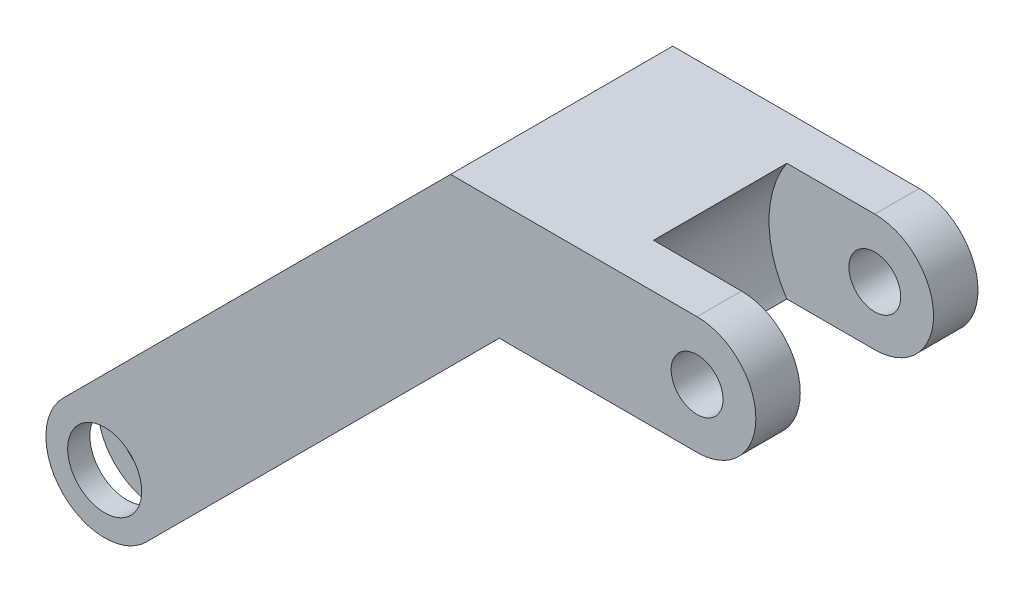
from build123d import *

# Parameters (mm, degrees)
SALIENTE_EXTRUIR1_DEPTH = 7.5
CROQUIS2_W              = 2
CROQUIS2_H              = 3.96875
CORTAR_EXTRUIR1_DEPTH   = 15
CROQUIS4_R              = 2.5
CORTAR_EXTRUIR2_DEPTH   = 15
CROQUIS5_R              = 7.14375
CORTAR_EXTRUIR3_DEPTH   = 4.5
CROQUIS13_R             = 1.75
CORTAR_EXTRUIR8_DEPTH   = 55.748876273
CROQUIS10_R             = 4
CROQUIS10_R_2           = 2
CORTAR_EXTRUIR7_DEPTH   = 1.5
NERVIO1_REACH           = 55.185
CROQUIS12_WALL_W        = 119.773509912
CROQUIS12_WALL_H        = 3


with BuildPart() as part:
    # Croquis1 → Saliente-Extruir1 (new, symmetric)
    with BuildSketch(Plane.XY):
        with BuildLine():
            Line((23.356089924, 28.96875), (-2.806330038, 2.806330038))
            ThreePointArc((-2.806330038, 2.806330038), (-2.806330038, -2.806330038), (2.806330038, -2.806330038))
            Line((2.806330038, -2.806330038), (26.643910076, 21.03125))
            Line((26.643910076, 21.03125), (40, 21.03125))
            ThreePointArc((40, 21.03125), (43.96875, 25), (40, 28.96875))
            Line((40, 28.96875), (23.356089924, 28.96875))
        make_face()
    extrude(amount=SALIENTE_EXTRUIR1_DEPTH, both=True)

    # Croquis2 → Cortar-Extruir1 (cut)
    with BuildSketch(Plane(origin=(-2.806330038, 2.806330038, 0), x_dir=(0, 0, 1), z_dir=(-0.7071067811865441, 0.7071067811865509, 0))):
        with Locations((-5, -1.984375)):
            Rectangle(CROQUIS2_W, CROQUIS2_H)
        with Locations((5, -1.984375)):
            Rectangle(CROQUIS2_W, CROQUIS2_H)
    extrude(amount=-CORTAR_EXTRUIR1_DEPTH, mode=Mode.SUBTRACT)

    # Croquis4 → Cortar-Extruir2 (cut)
    with BuildSketch(Plane.XY.offset(7.5)):
        Circle(CROQUIS4_R)
    extrude(amount=-CORTAR_EXTRUIR2_DEPTH, mode=Mode.SUBTRACT)

    # Croquis5 → Cortar-Extruir3 (cut, symmetric)
    with BuildSketch(Plane.XY):
        with Locations((40, 25)):
            Circle(CROQUIS5_R)
    extrude(amount=CORTAR_EXTRUIR3_DEPTH, both=True, mode=Mode.SUBTRACT)

    # Croquis13 → Cortar-Extruir8 (cut, through all)
    with BuildSketch(Plane.XY.offset(7.5)):
        with Locations((40, 25)):
            Circle(CROQUIS13_R)
    extrude(amount=-CORTAR_EXTRUIR8_DEPTH, mode=Mode.SUBTRACT)

    # Croquis10 → Cortar-Extruir7 (cut, symmetric)
    with BuildSketch(Plane.XY):
        with Locations((17.5, 11.887339924)):
            Circle(CROQUIS10_R)
        with Locations((17.5, 11.887339924)):
            Circle(CROQUIS10_R_2, mode=Mode.SUBTRACT)
    extrude(amount=CORTAR_EXTRUIR7_DEPTH, both=True, mode=Mode.SUBTRACT)

    # Croquis12 wall → Nervio1 (add, up to next)
    with BuildSketch(Plane(origin=(27.982932557, 19.03125, 0), x_dir=(-0.936452144338, -0.350795355393, 0), z_dir=(0.350795355393, -0.936452144338, 0)), mode=Mode.PRIVATE) as nervio1_sk1:
        Rectangle(CROQUIS12_WALL_W, CROQUIS12_WALL_H)
    nervio1_tool1 = extrude(nervio1_sk1.sketch, amount=-NERVIO1_REACH, mode=Mode.PRIVATE) - part.part
    add(nervio1_tool1.solids().sort_by_distance((27.982932557, 19.03125, 0))[0])


solid = part.part
